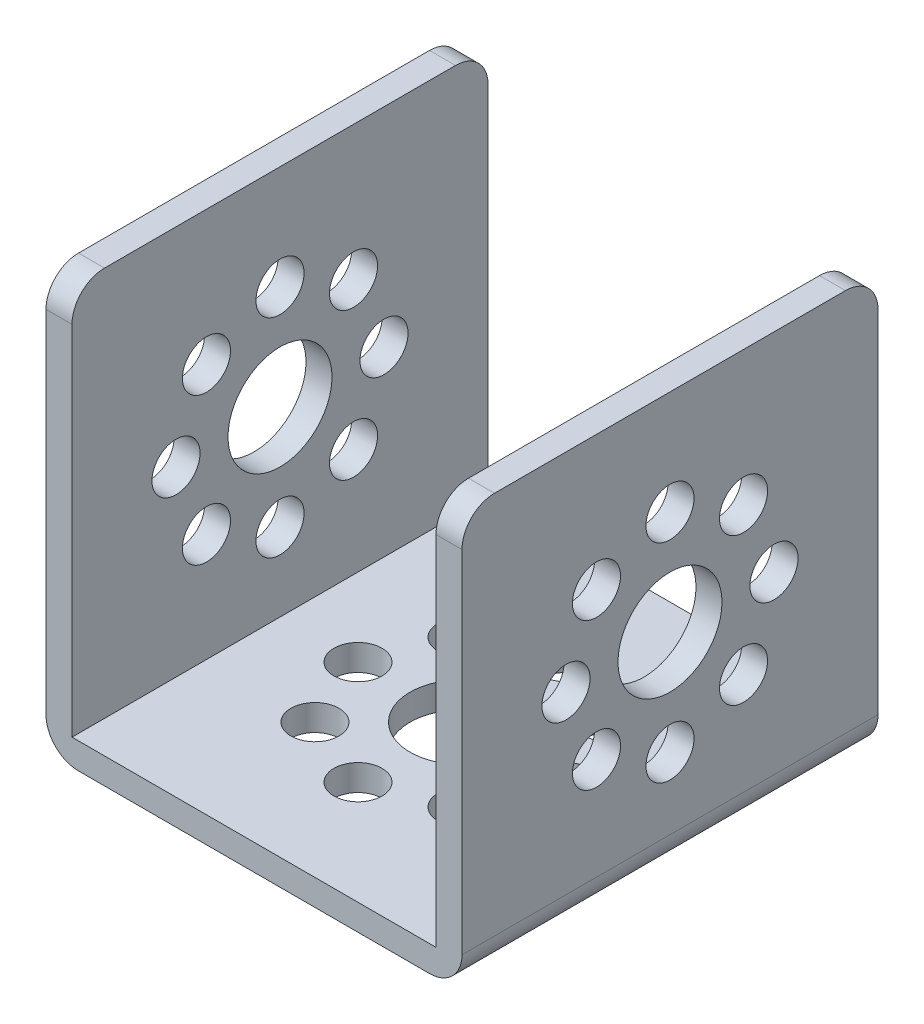
from build123d import *

# Parameters (mm, degrees)
SKETCH1_W                      = 32
SKETCH1_H                      = 32
BOSS_EXTRUDE1_DEPTH            = 32
SKETCH2_W                      = 28
SKETCH2_H                      = 30
CUT_EXTRUDE1_DEPTH             = 49
F_8_0_8_DIAMETER_HOLE1_D       = 8
F_8_0_8_DIAMETER_HOLE1_DEPTH   = 2
F_3_7_3_7_DIAMETER_HOLE1_D     = 3.7
F_3_7_3_7_DIAMETER_HOLE1_DEPTH = 2
F_3_7_3_7_DIAMETER_HOLE2_D     = 3.7
F_8_0_8_DIAMETER_HOLE2_D       = 8
F_8_0_8_DIAMETER_HOLE2_DEPTH   = 32
F_8_0_8_DIAMETER_HOLE3_D       = 8
F_8_0_8_DIAMETER_HOLE3_DEPTH   = 32
F_3_7_3_7_DIAMETER_HOLE3_D     = 3.7
F_3_7_3_7_DIAMETER_HOLE3_DEPTH = 32
FILLET1_R                      = 2.5


with BuildPart() as part:
    # Sketch1 → Boss-Extrude1 (new body)
    with BuildSketch(Plane(origin=(16, 0, 0), x_dir=(0, 0, -1), z_dir=(1, 0, 0))):
        with Locations((0, 16)):
            Rectangle(SKETCH1_W, SKETCH1_H)
    extrude(amount=-BOSS_EXTRUDE1_DEPTH)

    # Sketch2 → Cut-Extrude1 (cut, through all)
    with BuildSketch(Plane(origin=(0, 0, -16), x_dir=(-1, 0, 0), z_dir=(0, 0, -1))):
        with Locations((0, 17)):
            Rectangle(SKETCH2_W, SKETCH2_H)
    extrude(amount=-CUT_EXTRUDE1_DEPTH, mode=Mode.SUBTRACT)

    # Ø8.0 (8) Diameter Hole1
    with Locations(Plane.ZY.offset(16)):
        with Locations((0, 16)):
            Hole(F_8_0_8_DIAMETER_HOLE1_D / 2, depth=F_8_0_8_DIAMETER_HOLE1_DEPTH)

    # Ø3.7 (3.7) Diameter Hole1
    with Locations(Plane.ZY.offset(16)):
        with Locations((-8, 16), (0, 24), (8, 16), (0, 8), (-5.656854249, 21.656854249), (5.656854249, 21.656854249), (5.656854249, 10.343145751), (-5.656854249, 10.343145751)):
            Hole(F_3_7_3_7_DIAMETER_HOLE1_D / 2, depth=F_3_7_3_7_DIAMETER_HOLE1_DEPTH)

    # Ø3.7 (3.7) Diameter Hole2 (through all)
    with Locations(Plane(origin=(0, 2, 0), x_dir=(1, 0, 0), z_dir=(0, 1, 0))):
        with Locations((8, 0), (0, 8), (-8, 0), (0, -8), (5.656854249, 5.656854249), (-5.656854249, 5.656854249), (-5.656854249, -5.656854249), (5.656854249, -5.656854249)):
            Hole(F_3_7_3_7_DIAMETER_HOLE2_D / 2)

    # Ø8.0 (8) Diameter Hole2
    with Locations(Plane(origin=(0, 0, 0), x_dir=(-1, 0, 0), z_dir=(0, -1, 0))):
        with Locations((0, 0)):
            Hole(F_8_0_8_DIAMETER_HOLE2_D / 2, depth=F_8_0_8_DIAMETER_HOLE2_DEPTH)

    # Ø8.0 (8) Diameter Hole3
    with Locations(Plane(origin=(16, 0, 0), x_dir=(0, 0, -1), z_dir=(1, 0, 0))):
        with Locations((0, 16)):
            Hole(F_8_0_8_DIAMETER_HOLE3_D / 2, depth=F_8_0_8_DIAMETER_HOLE3_DEPTH)

    # Ø3.7 (3.7) Diameter Hole3
    with Locations(Plane(origin=(16, 0, 0), x_dir=(0, 0, -1), z_dir=(1, 0, 0))):
        with Locations((8, 16), (0, 24), (-8, 16), (0, 8), (5.656854249, 21.656854249), (-5.656854249, 21.656854249), (-5.656854249, 10.343145751), (5.656854249, 10.343145751)):
            Hole(F_3_7_3_7_DIAMETER_HOLE3_D / 2, depth=F_3_7_3_7_DIAMETER_HOLE3_DEPTH)

    # Fillet1
    fillet1_edges = [part.edges().sort_by_distance(p)[0] for p in [
        (-16, 0, 0),
        (-15, 32, 16),
        (-15, 32, -16),
        (16, 0, 0),
        (15, 32, 16),
        (15, 32, -16),
    ]]
    fillet(fillet1_edges, radius=FILLET1_R)


solid = part.part
